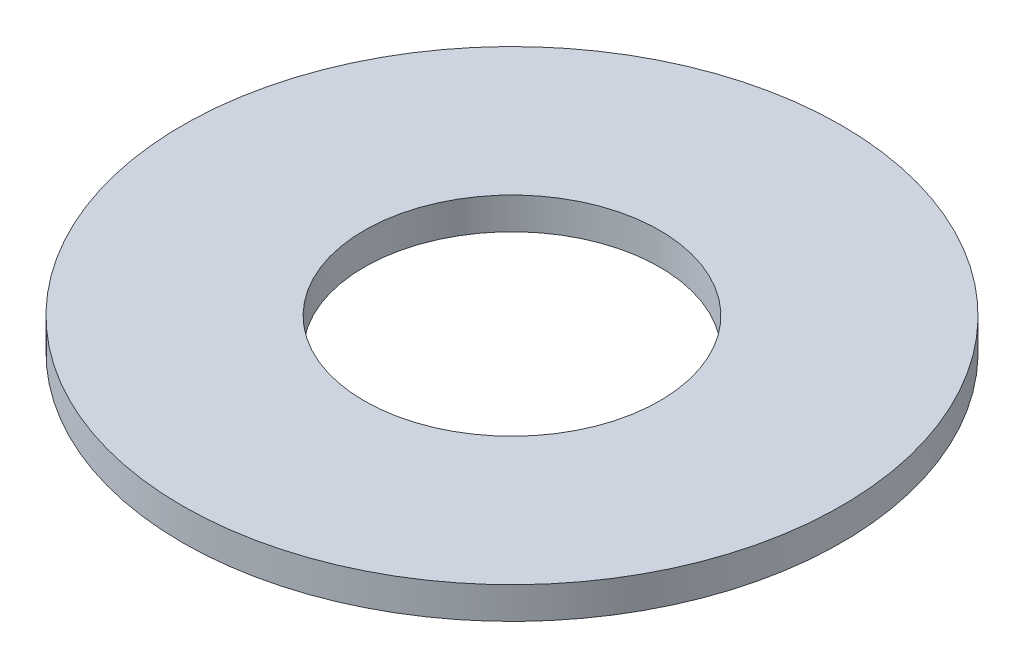
from build123d import *

# Parameters (mm, degrees)
SKETCH1_R           = 72.5
BOSS_EXTRUDE1_DEPTH = 7
SKETCH2_R           = 32.5
CUT_EXTRUDE1_DEPTH  = 103.769158798


with BuildPart() as part:
    # Sketch1 → Boss-Extrude1 (new body)
    with BuildSketch(Plane(origin=(0, 0, 0), x_dir=(1, 0, 0), z_dir=(0, 1, 0))):
        Circle(SKETCH1_R)
    extrude(amount=BOSS_EXTRUDE1_DEPTH)

    # Sketch2 → Cut-Extrude1 (cut, through all)
    with BuildSketch(Plane(origin=(0, 0, 0), x_dir=(1, 0, 0), z_dir=(0, 1, 0))):
        Circle(SKETCH2_R)
    extrude(amount=CUT_EXTRUDE1_DEPTH, mode=Mode.SUBTRACT)


solid = part.part
